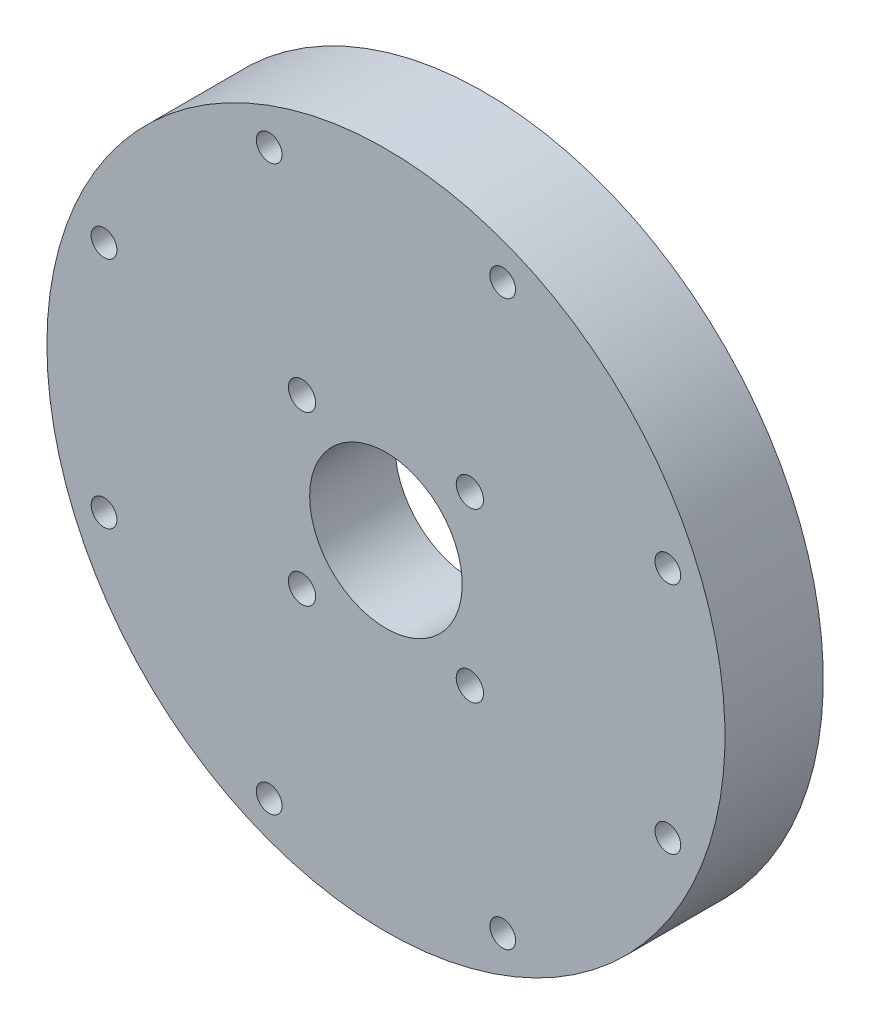
from build123d import *

# Parameters (mm, degrees)
SKETCH16_W                                      = 49.2125
SKETCH16_H                                      = 24.13
SKETCH18_R                                      = 63.5
VOLUTE_CUTOUT_DEPTH                             = 5.715
SKETCH4_R                                       = 2.413
FASTENER_HOLE_DEPTH                             = 93.987939703
FASTENER_HOLES_COUNT                            = 8
SKETCH17_R                                      = 32.512
IMPELLER_CLEARANCE_DEPTH                        = 8.128
CBORE_FOR_10_SOCKET_HEAD_CAP_SCREW1_D           = 5.1054
CBORE_FOR_10_SOCKET_HEAD_CAP_SCREW1_CBORE_D     = 9.525
CBORE_FOR_10_SOCKET_HEAD_CAP_SCREW1_CBORE_DEPTH = 4.826


with BuildPart() as part:
    # Sketch16 → Main Body (revolve)
    with BuildSketch(Plane(origin=(0, 0, 0), x_dir=(1, 0, 0), z_dir=(0, 1, 0))):
        with Locations((38.89375, -12.065)):
            Rectangle(SKETCH16_W, SKETCH16_H)
    revolve(axis=Axis((0, 0, 0), (0, 0, 1)))

    # Sketch18 → Volute Cutout (cut)
    with BuildSketch(Plane(origin=(0, 0, 0), x_dir=(-1, 0, 0), z_dir=(0, 0, -1))):
        Circle(SKETCH18_R)
        with BuildLine():
            ThreePointArc((-44.763213962, 0), (-43.883034366, 2.328238698), (-41.593494633, 3.304670655))
            Line((-41.593494633, 3.304670655), (-38.338438787, 3.304670655))
            ThreePointArc((-38.338438787, 3.304670655), (-35.382102361, 4.389545114), (-33.829218893, 7.129149209))
            add(Edge.make_bspline(
                [(-33.829218893, 7.129149209), (-33.734655008, 7.700712878), (-33.516311109, 8.842034383), (-33.102704602, 10.538150267), (-32.602833338, 12.216692386), (-32.017965922, 13.871662747), (-31.349191468, 15.498755899), (-30.5978199, 17.093716034), (-29.765379241, 18.652348338), (-28.85361226, 20.170530201), (-27.864472781, 21.644222235), (-26.800121479, 23.069479109), (-25.662921186, 24.442460162), (-24.455431695, 25.759439779), (-23.180404062, 27.016817518), (-21.840774402, 28.21112794), (-20.439657201, 29.339050137), (-18.980338149, 30.397416931), (-17.466266506, 31.383223709), (-15.90104702, 32.293636882), (-14.288431416, 33.126001944), (-12.632309463, 33.877851098), (-10.936699661, 34.546910451), (-9.205739549, 35.131106723), (-7.443675663, 35.628573491), (-5.654853178, 36.037656917), (-3.84370524, 36.356920959), (-2.014742036, 36.585152051), (-0.172539606, 36.721363228), (1.678271559, 36.764797689), (3.533018111, 36.714931787), (5.3869956, 36.571477434), (7.235480366, 36.334383913), (9.07374153, 36.003839086), (10.897053062, 35.58027), (12.700705888, 35.064342878), (14.480020006, 34.456962497), (16.230356593, 33.759270957), (17.947130045, 32.972645827), (19.625819949, 32.098697681), (21.261982935, 31.139267032), (22.851264382, 30.096420656), (24.389409957, 28.972447316), (25.872276938, 27.769852906), (27.29584531, 26.491355013), (28.656228591, 25.139876909), (29.949684369, 23.718540989), (31.17262451, 22.230661674), (32.32162502, 20.679737787), (33.393435533, 19.069444419), (34.384988385, 17.40362431), (35.293407272, 15.686278765), (36.11601545, 13.921558115), (36.850343459, 12.113751764), (37.494136352, 10.267277823), (38.045360401, 8.38667238), (38.502209273, 6.476578416), (38.863109645, 4.541734393), (39.126726243, 2.586962555), (39.291966303, 0.617156959), (39.357983419, -1.362728731), (39.324180782, -3.347693652), (39.190213789, -5.332702333), (38.955992027, -7.312697422), (38.621680597, -9.282612528), (38.187700803, -11.23738514), (37.654730183, -13.171969596), (37.023701879, -15.081350059), (36.295803353, -16.960553479), (35.472474446, -18.804662496), (34.555404779, -20.608828259), (33.546530503, -22.368283123), (32.448030404, -24.078353194), (31.26232137, -25.734470685), (29.992053224, -27.332186055), (28.640102943, -28.867179894), (27.209568266, -30.335274533), (25.70376071, -31.732445327), (24.12619801, -33.054831606), (22.480595995, -34.298747245), (20.770859922, -35.460690836), (19.001075294, -36.537355425), (17.175498164, -37.525637795), (15.298544973, -38.422647266), (13.374781932, -39.225713982), (11.408913967, -39.93239668), (9.405773269, -40.540489886), (7.370307471, -41.048030557), (5.307567475, -41.453304115), (3.222694963, -41.754849874), (1.120909625, -41.951465843), (-0.992503863, -42.042212881), (-3.11220909, -42.026418195), (-5.232831344, -41.903678173), (-7.348971199, -41.673860539), (-9.455218223, -41.337105816), (-11.546164776, -40.893828104), (-13.616419848, -40.344715153), (-15.660622923, -39.690727741), (-17.673457812, -38.93309834), (-19.649666438, -38.073329092), (-21.584062524, -37.113189077), (-23.471545152, -36.054710891), (-25.307112165, -34.900186527), (-27.085873367, -33.652162581), (-28.803063488, -32.313434789), (-30.454054887, -30.887041888), (-32.034369952, -29.376258848), (-33.539693165, -27.784589454), (-34.9658828, -26.115758288), (-36.30898223, -24.373702093), (-37.565230795, -22.562560578), (-38.731074224, -20.686666652), (-39.803174556, -18.750536124), (-40.778419563, -16.758856904), (-41.653931621, -14.716477704), (-42.427076016, -12.628396291), (-43.09546867, -10.499747309), (-43.656983249, -8.335789696), (-44.109757635, -6.141893742), (-44.437890089, -4.016226935), (-44.606204477, -2.433517734), (-44.678884826, -1.499236103), (-44.704449619, -1.124895611), (-44.721871029, -0.843919777), (-44.737493089, -0.562768038), (-44.751475519, -0.281457909), (-44.759300821, -0.093827142), (-44.763213962, 0)],
                knots=[0.028896694, 0.028896694, 0.028896694, 0.028896694, 0.0359159, 0.042971309, 0.050042349, 0.057129073, 0.064231529, 0.071349764, 0.078483823, 0.085633747, 0.092799578, 0.099981356, 0.107179117, 0.1143929, 0.121622741, 0.128868673, 0.136130732, 0.14340895, 0.15070336, 0.158013994, 0.165340883, 0.172684057, 0.180043546, 0.18741938, 0.194811587, 0.202220196, 0.209645235, 0.217086731, 0.224544712, 0.232019203, 0.239510231, 0.247017823, 0.254542004, 0.262082798, 0.269640231, 0.277214328, 0.284805113, 0.29241261, 0.300036843, 0.307677836, 0.31533561, 0.323010191, 0.3307016, 0.338409861, 0.346134995, 0.353877025, 0.361635972, 0.369411859, 0.377204707, 0.385014537, 0.392841372, 0.40068523, 0.408546135, 0.416424105, 0.424319163, 0.432231327, 0.440160619, 0.448107058, 0.456070665, 0.464051459, 0.47204946, 0.480064687, 0.48809716, 0.496146898, 0.50421392, 0.512298245, 0.520399892, 0.52851888, 0.536655227, 0.544808952, 0.552980073, 0.561168609, 0.569374578, 0.577597998, 0.585838887, 0.594097262, 0.602373142, 0.610666545, 0.618977488, 0.627305988, 0.635652063, 0.64401573, 0.652397007, 0.66079591, 0.669212457, 0.677646665, 0.686098551, 0.694568131, 0.703055422, 0.711560441, 0.720083205, 0.728623729, 0.737182031, 0.745758127, 0.754352033, 0.762963766, 0.771593341, 0.780240774, 0.788906083, 0.797589282, 0.806290387, 0.815009415, 0.823746381, 0.8325013, 0.841274189, 0.850065063, 0.858873938, 0.867700829, 0.876545751, 0.885408719, 0.89428975, 0.903188858, 0.912106059, 0.921041367, 0.929994798, 0.938966366, 0.947956087, 0.956963975, 0.965990046, 0.975034314, 0.984096794, 0.992041415, 0.994313871, 0.995450526, 0.996587467, 0.997724693, 0.998862204, 1, 1, 1, 1], degree=3))
        make_face(mode=Mode.SUBTRACT)
    extrude(amount=-VOLUTE_CUTOUT_DEPTH, mode=Mode.SUBTRACT)

    # Sketch4 → Fastener Hole (cut, through all)
    with BuildSketch(Plane.XY.offset(24.13)):
        with Locations((52.799715283, -21.87035816)):
            Circle(SKETCH4_R)
    fastener_hole = extrude(amount=-FASTENER_HOLE_DEPTH, mode=Mode.SUBTRACT)

    # Fastener Holes: Fastener Hole ×8 about axis
    fastener_holes_axis = Axis((0, 0, 0), (0, 0, -1))
    for i in range(1, FASTENER_HOLES_COUNT):
        add(fastener_hole.rotate(fastener_holes_axis, i * 360 / FASTENER_HOLES_COUNT), mode=Mode.SUBTRACT)

    # Sketch17 → Impeller Clearance (cut)
    with BuildSketch(Plane(origin=(0, 0, 0), x_dir=(-1, 0, 0), z_dir=(0, 0, -1))):
        Circle(SKETCH17_R)
    extrude(amount=-IMPELLER_CLEARANCE_DEPTH, mode=Mode.SUBTRACT)

    # CBORE for #10 Socket Head Cap Screw1 (through all)
    with Locations(Plane(origin=(15.715448212, -15.715448212, 8.128), x_dir=(-1, 0, 0), z_dir=(0, 0, -1))):
        with Locations((0, 0), (0, 31.430896424), (31.430896424, 31.430896424), (31.430896424, 0)):
            CounterBoreHole(CBORE_FOR_10_SOCKET_HEAD_CAP_SCREW1_D / 2, CBORE_FOR_10_SOCKET_HEAD_CAP_SCREW1_CBORE_D / 2, CBORE_FOR_10_SOCKET_HEAD_CAP_SCREW1_CBORE_DEPTH)


solid = part.part
